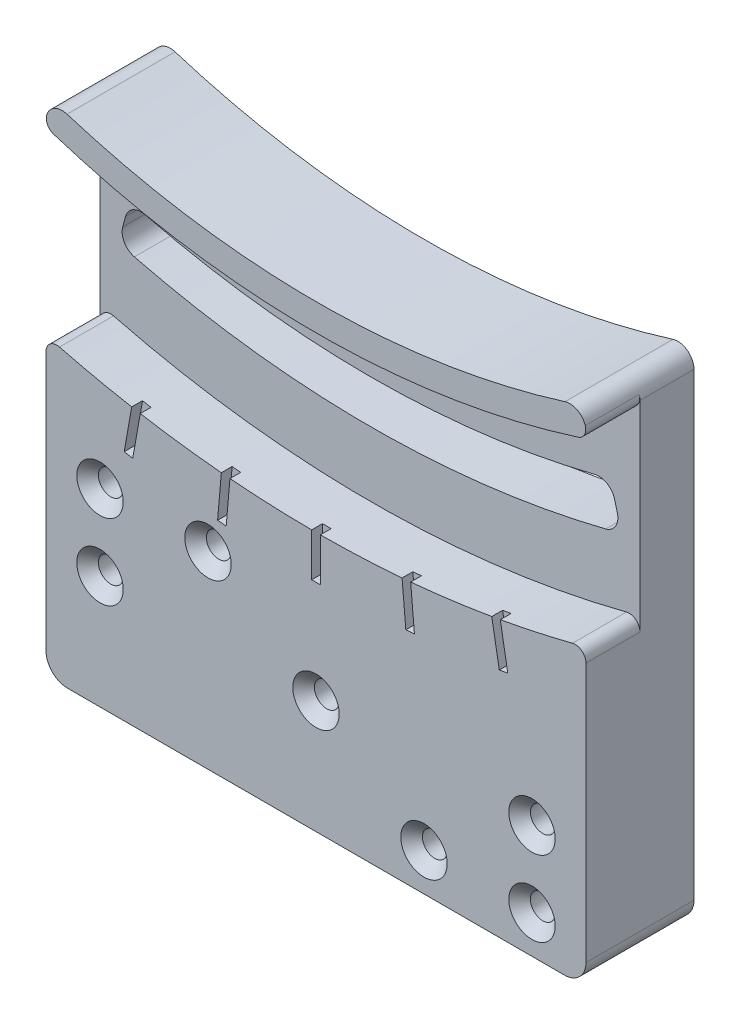
from build123d import *

# Parameters (mm, degrees)
SKETCH1_W           = 50
SKETCH1_H           = 21
SKETCH1_R           = 1.15
BOSS_EXTRUDE4_DEPTH = 10
CHAMFER2_SIZE       = 1
FILLET2_R           = 2
SKETCH2_W           = 50
SKETCH2_H           = 10
BOSS_EXTRUDE5_DEPTH = 40
CUT_EXTRUDE1_DEPTH  = 73
CUT_EXTRUDE2_DEPTH  = 5
CUT_EXTRUDE3_DEPTH  = 1
FILLET4_R           = 1.5
FILLET6_R           = 1.5
FILLET7_R           = 1


with BuildPart() as part:
    # Sketch1 → Boss-Extrude4 (new body)
    with BuildSketch(Plane.XY):
        with Locations((3.499954481, 0.020373254)):
            Rectangle(SKETCH1_W, SKETCH1_H)
        with Locations((-16.500045519, 0.020373254)):
            Circle(SKETCH1_R, mode=Mode.SUBTRACT)
        with Locations((13.499954481, -6.979626746)):
            Circle(SKETCH1_R, mode=Mode.SUBTRACT)
        with Locations((23.499954481, -6.979626746)):
            Circle(SKETCH1_R, mode=Mode.SUBTRACT)
        with Locations((-16.500045519, 7.020373254)):
            Circle(SKETCH1_R, mode=Mode.SUBTRACT)
        with Locations((-6.500045519, 7.020373254)):
            Circle(SKETCH1_R, mode=Mode.SUBTRACT)
        with Locations((3.499954481, 0.020373254)):
            Circle(SKETCH1_R, mode=Mode.SUBTRACT)
        with Locations((23.499954481, 0.020373254)):
            Circle(SKETCH1_R, mode=Mode.SUBTRACT)
    extrude(amount=BOSS_EXTRUDE4_DEPTH)

    # Chamfer2
    chamfer2_edges = [part.edges().sort_by_distance(p)[0] for p in [
        (22.349954481, 0.020373254, 10),
        (-17.650045519, 0.020373254, 10),
        (-17.650045519, 7.020373254, 10),
        (-7.650045519, 7.020373254, 10),
        (22.349954481, -6.979626746, 10),
        (12.349954481, -6.979626746, 10),
        (2.349954481, 0.020373254, 10),
    ]]
    chamfer(chamfer2_edges, length=CHAMFER2_SIZE)

    # Fillet2
    fillet2_edges = [part.edges().sort_by_distance(p)[0] for p in [
        (28.499954481, -10.479626746, 5),
        (-21.500045519, -10.479626746, 5),
    ]]
    fillet(fillet2_edges, radius=FILLET2_R)

    # Sketch2 → Boss-Extrude5 (add)
    with BuildSketch(Plane(origin=(0, 10.520373254, 0), x_dir=(1, 0, 0), z_dir=(0, 1, 0))):
        with Locations((3.499954481, -5)):
            Rectangle(SKETCH2_W, SKETCH2_H)
    extrude(amount=BOSS_EXTRUDE5_DEPTH)

    # Sketch4 → Cut-Extrude1 (cut)
    with BuildSketch(Plane.XY.offset(10)):
        with BuildLine():
            Line((26.79366854, 22.587048888), (25.75839236, 26.450752193))
            ThreePointArc((25.75839236, 26.450752193), (3.499954481, 23.520373254), (-18.758483398, 26.450752193))
            Line((-18.758483398, 26.450752193), (-19.793759578, 22.587048888))
            ThreePointArc((-19.793759578, 22.587048888), (3.499954481, 19.520373254), (26.79366854, 22.587048888))
        make_face()
        with BuildLine():
            ThreePointArc((-21.500045519, 36.163369499), (3.499954481, 32.020373254), (28.499954481, 36.163369499))
            Line((28.499954481, 36.163369499), (28.499954481, 50.520373254))
            Line((28.499954481, 50.520373254), (-21.500045519, 50.520373254))
            Line((-21.500045519, 50.520373254), (-21.500045519, 36.163369499))
        make_face()
    extrude(amount=-CUT_EXTRUDE1_DEPTH, mode=Mode.SUBTRACT)

    # Sketch4<3> → Cut-Extrude2 (cut)
    with BuildSketch(Plane.XY.offset(10)):
        with BuildLine():
            Line((28.499954481, 17.764584387), (28.499954481, 23.062290925))
            ThreePointArc((28.499954481, 23.062290925), (27.647980656, 22.820472263), (26.79366854, 22.587048888))
            ThreePointArc((26.79366854, 22.587048888), (3.499954481, 19.520373254), (-19.793759578, 22.587048888))
            ThreePointArc((-19.793759578, 22.587048888), (-20.648071694, 22.820472263), (-21.500045519, 23.062290925))
            Line((-21.500045519, 23.062290925), (-21.500045519, 17.764584387))
            Line((-21.500045519, 17.764584387), (-20.697767999, 20.758724854))
            Line((-20.697767999, 20.758724854), (-19.925027338, 20.551669618))
            Line((-19.925027338, 20.551669618), (-20.960087835, 16.688771254))
            ThreePointArc((-20.960087835, 16.688771254), (-17.278248457, 15.795956571), (-13.564048969, 15.049108913))
            Line((-13.564048969, 15.049108913), (-12.869600966, 18.987519248))
            Line((-12.869600966, 18.987519248), (-12.081754763, 18.848600706))
            Line((-12.081754763, 18.848600706), (-12.776202766, 14.910190371))
            ThreePointArc((-12.776202766, 14.910190371), (-9.030559972, 14.341666562), (-5.265402072, 13.9213747))
            Line((-5.265402072, 13.9213747), (-4.916851731, 17.905323327))
            Line((-4.916851731, 17.905323327), (-4.119895973, 17.835598733))
            Line((-4.119895973, 17.835598733), (-4.468446314, 13.851650106))
            ThreePointArc((-4.468446314, 13.851650106), (-0.687506706, 13.611743982), (3.099954481, 13.521206591))
            Line((3.099954481, 13.521206591), (3.099954481, 17.520373254))
            Line((3.099954481, 17.520373254), (3.899954481, 17.520373254))
            Line((3.899954481, 17.520373254), (3.899954481, 13.521206591))
            ThreePointArc((3.899954481, 13.521206591), (7.687415668, 13.611743982), (11.468355275, 13.851650106))
            Line((11.468355275, 13.851650106), (11.119804934, 17.835598733))
            Line((11.119804934, 17.835598733), (11.916760693, 17.905323327))
            Line((11.916760693, 17.905323327), (12.265311034, 13.9213747))
            ThreePointArc((12.265311034, 13.9213747), (16.030468934, 14.341666562), (19.776111728, 14.910190371))
            Line((19.776111728, 14.910190371), (19.081663725, 18.848600706))
            Line((19.081663725, 18.848600706), (19.869509927, 18.987519248))
            Line((19.869509927, 18.987519248), (20.563957931, 15.049108913))
            ThreePointArc((20.563957931, 15.049108913), (24.278157419, 15.795956571), (27.959996797, 16.688771254))
            Line((27.959996797, 16.688771254), (26.9249363, 20.551669618))
            Line((26.9249363, 20.551669618), (27.697676961, 20.758724854))
            Line((27.697676961, 20.758724854), (28.499954481, 17.764584387))
        make_face()
        with BuildLine():
            ThreePointArc((25.75839236, 26.450752193), (27.132420907, 26.831156723), (28.499954481, 27.234286946))
            Line((28.499954481, 27.234286946), (28.499954481, 33.526952486))
            ThreePointArc((28.499954481, 33.526952486), (3.499954481, 29.520373254), (-21.500045519, 33.526952486))
            Line((-21.500045519, 33.526952486), (-21.500045519, 27.234286946))
            ThreePointArc((-21.500045519, 27.234286946), (-20.132511945, 26.831156723), (-18.758483398, 26.450752193))
            ThreePointArc((-18.758483398, 26.450752193), (3.499954481, 23.520373254), (25.75839236, 26.450752193))
        make_face()
        with BuildLine():
            Line((28.499954481, 23.062290925), (28.499954481, 27.234286946))
            ThreePointArc((28.499954481, 27.234286946), (27.132420907, 26.831156723), (25.75839236, 26.450752193))
            Line((25.75839236, 26.450752193), (26.79366854, 22.587048888))
            ThreePointArc((26.79366854, 22.587048888), (27.647980656, 22.820472263), (28.499954481, 23.062290925))
        make_face()
        with BuildLine():
            ThreePointArc((-18.758483398, 26.450752193), (-20.132511945, 26.831156723), (-21.500045519, 27.234286946))
            Line((-21.500045519, 27.234286946), (-21.500045519, 23.062290925))
            ThreePointArc((-21.500045519, 23.062290925), (-20.648071694, 22.820472263), (-19.793759578, 22.587048888))
            Line((-19.793759578, 22.587048888), (-18.758483398, 26.450752193))
        make_face()
        with BuildLine():
            Line((28.499954481, 16.832725749), (28.499954481, 17.764584387))
            Line((28.499954481, 17.764584387), (27.697676961, 20.758724854))
            Line((27.697676961, 20.758724854), (26.9249363, 20.551669618))
            Line((26.9249363, 20.551669618), (27.959996797, 16.688771254))
            ThreePointArc((27.959996797, 16.688771254), (28.230080384, 16.760355613), (28.499954481, 16.832725749))
        make_face()
        with BuildLine():
            ThreePointArc((19.776111728, 14.910190371), (20.170179537, 14.978828965), (20.563957931, 15.049108913))
            Line((20.563957931, 15.049108913), (19.869509927, 18.987519248))
            Line((19.869509927, 18.987519248), (19.081663725, 18.848600706))
            Line((19.081663725, 18.848600706), (19.776111728, 14.910190371))
        make_face()
        with BuildLine():
            ThreePointArc((11.468355275, 13.851650106), (11.866905785, 13.885682238), (12.265311034, 13.9213747))
            Line((12.265311034, 13.9213747), (11.916760693, 17.905323327))
            Line((11.916760693, 17.905323327), (11.119804934, 17.835598733))
            Line((11.119804934, 17.835598733), (11.468355275, 13.851650106))
        make_face()
        with BuildLine():
            ThreePointArc((3.099954481, 13.521206591), (3.499954481, 13.520373254), (3.899954481, 13.521206591))
            Line((3.899954481, 13.521206591), (3.899954481, 17.520373254))
            Line((3.899954481, 17.520373254), (3.099954481, 17.520373254))
            Line((3.099954481, 17.520373254), (3.099954481, 13.521206591))
        make_face()
        with BuildLine():
            Line((-4.916851731, 17.905323327), (-5.265402072, 13.9213747))
            ThreePointArc((-5.265402072, 13.9213747), (-4.866996823, 13.885682238), (-4.468446314, 13.851650106))
            Line((-4.468446314, 13.851650106), (-4.119895973, 17.835598733))
            Line((-4.119895973, 17.835598733), (-4.916851731, 17.905323327))
        make_face()
        with BuildLine():
            Line((-12.869600966, 18.987519248), (-13.564048969, 15.049108913))
            ThreePointArc((-13.564048969, 15.049108913), (-13.170270575, 14.978828965), (-12.776202766, 14.910190371))
            Line((-12.776202766, 14.910190371), (-12.081754763, 18.848600706))
            Line((-12.081754763, 18.848600706), (-12.869600966, 18.987519248))
        make_face()
        with BuildLine():
            Line((-20.697767999, 20.758724854), (-21.500045519, 17.764584387))
            Line((-21.500045519, 17.764584387), (-21.500045519, 16.832725749))
            ThreePointArc((-21.500045519, 16.832725749), (-21.230171422, 16.760355613), (-20.960087835, 16.688771254))
            Line((-20.960087835, 16.688771254), (-19.925027338, 20.551669618))
            Line((-19.925027338, 20.551669618), (-20.697767999, 20.758724854))
        make_face()
    extrude(amount=-CUT_EXTRUDE2_DEPTH, mode=Mode.SUBTRACT)

    # Sketch4<4> → Cut-Extrude3 (cut)
    with BuildSketch(Plane.XY.offset(10)):
        with BuildLine():
            Line((3.899954481, 9.520373254), (3.899954481, 13.521206591))
            ThreePointArc((3.899954481, 13.521206591), (3.499954481, 13.520373254), (3.099954481, 13.521206591))
            Line((3.099954481, 13.521206591), (3.099954481, 9.520373254))
            Line((3.099954481, 9.520373254), (3.899954481, 9.520373254))
        make_face()
        with BuildLine():
            ThreePointArc((12.265311034, 13.9213747), (11.866905785, 13.885682238), (11.468355275, 13.851650106))
            Line((11.468355275, 13.851650106), (11.817050876, 9.866041148))
            Line((11.817050876, 9.866041148), (12.614006635, 9.935765742))
            Line((12.614006635, 9.935765742), (12.265311034, 13.9213747))
        make_face()
        with BuildLine():
            Line((-4.817141915, 9.866041148), (-4.468446314, 13.851650106))
            ThreePointArc((-4.468446314, 13.851650106), (-4.866996823, 13.885682238), (-5.265402072, 13.9213747))
            Line((-5.265402072, 13.9213747), (-5.614097673, 9.935765742))
            Line((-5.614097673, 9.935765742), (-4.817141915, 9.866041148))
        make_face()
        with BuildLine():
            ThreePointArc((20.563957931, 15.049108913), (20.170179537, 14.978828965), (19.776111728, 14.910190371))
            Line((19.776111728, 14.910190371), (20.470849146, 10.970138682))
            Line((20.470849146, 10.970138682), (21.258695349, 11.109057224))
            Line((21.258695349, 11.109057224), (20.563957931, 15.049108913))
        make_face()
        with BuildLine():
            Line((-13.470940185, 10.970138682), (-12.776202766, 14.910190371))
            ThreePointArc((-12.776202766, 14.910190371), (-13.170270575, 14.978828965), (-13.564048969, 15.049108913))
            Line((-13.564048969, 15.049108913), (-14.258786387, 11.109057224))
            Line((-14.258786387, 11.109057224), (-13.470940185, 10.970138682))
        make_face()
    extrude(amount=-CUT_EXTRUDE3_DEPTH, mode=Mode.SUBTRACT)

    # Fillet4
    fillet4_edges = [part.edges().sort_by_distance(p)[0] for p in [
        (-18.758483398, 26.450752193, 2.5),
        (25.75839236, 26.450752193, 2.5),
        (26.79366854, 22.587048888, 2.5),
        (-19.793759578, 22.587048888, 2.5),
    ]]
    fillet(fillet4_edges, radius=FILLET4_R)

    # Fillet6
    fillet6_edges = [part.edges().sort_by_distance(p)[0] for p in [
        (28.499954481, 36.163369499, 5),
        (-21.500045519, 36.163369499, 5),
    ]]
    fillet(fillet6_edges, radius=FILLET6_R)

    # Fillet7
    # the kernel refuses this fillet: 1 mm, written as the material it takes off along each edge
    with BuildSketch(Plane(origin=(28.499954481, 33.526952486, 12.556756315), x_dir=(-0.0677828444913723, 0.9977000982222356, 0), z_dir=(0, 0, -1))) as fillet7_piece_1:
        with BuildLine():
            CenterArc((0.787555748, -0.971959872), FILLET7_R, 76.399725049, 89.818683939)
            Line((-0.183655122, -0.73373845), (-0.280776209, -0.709916308))
            ThreePointArc((-0.280776209, -0.709916308), (-0.189702109, -0.342371174), (-0.096891518, 0.024739315))
            Line((-0.096891518, 0.024739315), (-0.006778284, 0.09977001))
            ThreePointArc((-0.006778284, 0.09977001), (0.561529809, 0.138380349), (1.046217204, 0.097195987))
            Line((1.046217204, 0.097195987), (1.022702526, 0))
        make_face()
    extrude(amount=7.556756315, mode=Mode.SUBTRACT)
    with BuildSketch(Plane(origin=(28.499954481, 16.832725749, 13.240984234), x_dir=(0, -1, 0), z_dir=(0, 0, -1))) as fillet7_piece_2:
        with BuildLine():
            CenterArc((1.296393694, 1), FILLET7_R, 165.67494806, 104.32505194)
            ThreePointArc((0.327486052, 1.24742268), (0.165837833, 0.62316139), (0, 0))
            Line((0, 0), (1.296393694, 0))
        make_face()
    extrude(amount=8.240984234, mode=Mode.SUBTRACT)
    with BuildSketch(Plane(origin=(-21.500045519, 16.832725749, 13.240984234), x_dir=(0, -1, 0), z_dir=(0, 0, -1))) as fillet7_piece_3:
        with BuildLine():
            CenterArc((1.296393694, -1), FILLET7_R, 90, 104.32505194)
            ThreePointArc((0.327486052, -1.24742268), (0.165837833, -0.62316139), (0, 0))
            Line((0, 0), (1.296393694, 0))
        make_face()
    extrude(amount=8.240984234, mode=Mode.SUBTRACT)
    with BuildSketch(Plane(origin=(-21.500045519, 33.526952486, 12.556756315), x_dir=(0.0677828444913778, 0.9977000982222352, 0), z_dir=(0, 0, -1))) as fillet7_piece_4:
        with BuildLine():
            CenterArc((0.787555748, 0.971959872), FILLET7_R, 193.781591011, 89.818683939)
            Line((-0.183655122, 0.73373845), (-0.280776209, 0.709916308))
            ThreePointArc((-0.280776209, 0.709916308), (-0.189702109, 0.342371174), (-0.096891518, -0.024739315))
            Line((-0.096891518, -0.024739315), (-0.006778284, -0.09977001))
            ThreePointArc((-0.006778284, -0.09977001), (0.561529809, -0.138380349), (1.046217204, -0.097195987))
            Line((1.046217204, -0.097195987), (1.022702526, 0))
        make_face()
    extrude(amount=7.556756315, mode=Mode.SUBTRACT)


solid = part.part
